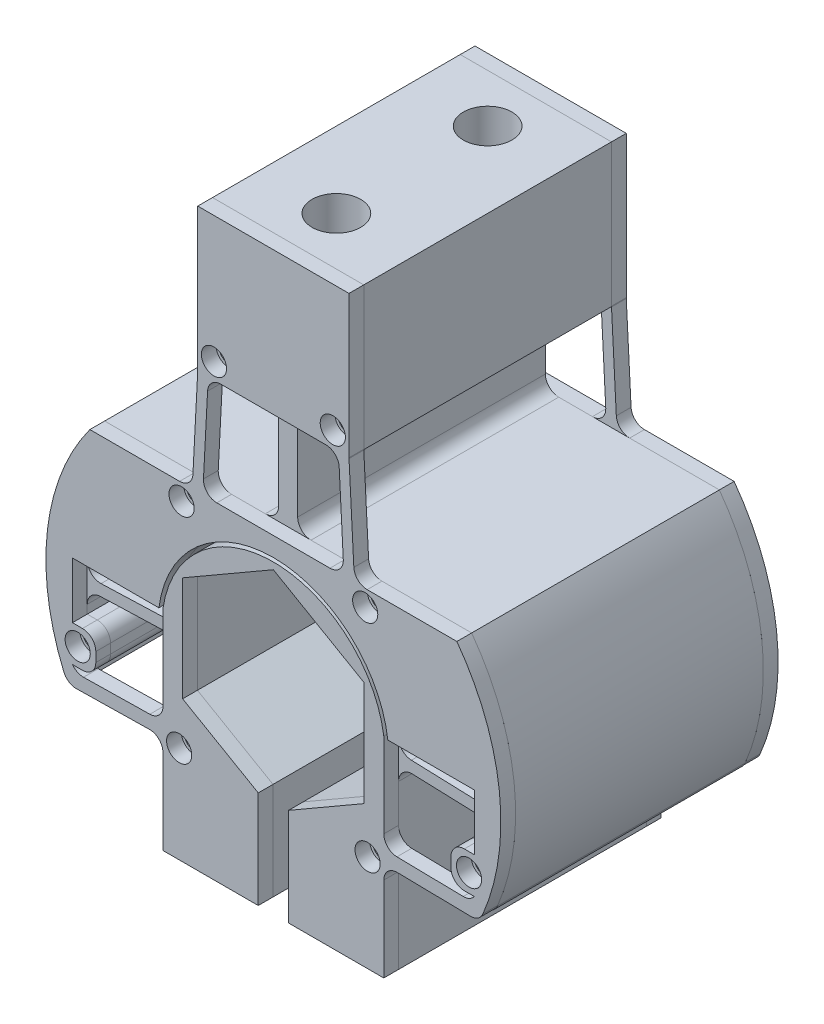
from build123d import *

# Parameters (mm, degrees)
MONKEY_CENTER_W                      = 15.875
MONKEY_CENTER_H                      = 14.97508695
MONKEY_CENTER_W_2                    = 2
MONKEY_CENTER_H_2                    = 11
MONKEY_CENTER_W_3                    = 3.8
MONKEY_CENTER_H_3                    = 3.8
CENTRAL_MONKEY_DEPTH                 = 13
CENTRAL_MONKEY_FILLETS_R             = 1.4
MONKEY_FRONT_W                       = 15.875
MONKEY_FRONT_H                       = 14.97508695
MONKEY_FRONT_W_2                     = 3.8
MONKEY_FRONT_H_2                     = 3.8
FRONT_MONKEY_DEPTH                   = 1.55
FRONT_MONKEY_FILLETS_START           = 13
FRONT_MONKEY_FILLETS_DEPTH           = 1.55
FRONT_MONKEY_FILLETS_2_DEPTH         = 1.55
TAP_DRILL_FOR_3_48_TAP1_AT_2_COUNT   = 2
TAP_DRILL_FOR_3_48_TAP1_AT_2_PITCH   = 14.795945391
TAP_DRILL_FOR_3_48_TAP1_AT_3_COUNT   = 2
TAP_DRILL_FOR_3_48_TAP1_AT_3_PITCH   = 21.43304983
TAP_DRILL_FOR_3_48_TAP1_AT_4_COUNT   = 2
TAP_DRILL_FOR_3_48_TAP1_AT_4_PITCH   = 19.275
TAP_DRILL_FOR_3_48_TAP1_AT_5_COUNT   = 2
TAP_DRILL_FOR_3_48_TAP1_AT_5_PITCH   = 29.842414874
TAP_DRILL_FOR_3_48_TAP1_AT_6_COUNT   = 2
TAP_DRILL_FOR_3_48_TAP1_AT_6_PITCH   = 22.570037672
TAP_DRILL_FOR_3_48_TAP1_AT_7_COUNT   = 2
TAP_DRILL_FOR_3_48_TAP1_AT_7_PITCH   = 21.618193154
TAP_DRILL_FOR_3_48_TAP1_AT_8_COUNT   = 2
TAP_DRILL_FOR_3_48_TAP1_AT_8_PITCH   = 35.483772956
SKETCH33_W                           = 1.3208
SKETCH33_H                           = 29.1
F_3_CLEARANCE_HOLE1_AT_2_COUNT       = 2
F_3_CLEARANCE_HOLE1_AT_2_PITCH       = 12.475
F_3_CLEARANCE_HOLE1_AT_3_COUNT       = 2
F_3_CLEARANCE_HOLE1_AT_3_PITCH       = 14.795945391
F_3_CLEARANCE_HOLE1_AT_4_COUNT       = 2
F_3_CLEARANCE_HOLE1_AT_4_PITCH       = 21.43304983
F_3_CLEARANCE_HOLE1_AT_5_COUNT       = 2
F_3_CLEARANCE_HOLE1_AT_5_PITCH       = 36.028447013
F_3_CLEARANCE_HOLE1_AT_6_COUNT       = 2
F_3_CLEARANCE_HOLE1_AT_6_PITCH       = 37.148402501
F_3_CLEARANCE_HOLE1_AT_7_COUNT       = 2
F_3_CLEARANCE_HOLE1_AT_7_PITCH       = 40.332331117
F_3_CLEARANCE_HOLE1_AT_8_COUNT       = 2
F_3_CLEARANCE_HOLE1_AT_8_PITCH       = 42.549733724
BOLTS_MIRROR_START                   = -16
BOLTS_MIRROR_OUTLINE_R               = 1.3208
BOLTS_MIRROR_DEPTH                   = 4
SKETCH16_W                           = 1.35255
SKETCH16_H                           = 10
TAP_DRILL_FOR_1_4_20_TAP1_AT_2_COUNT = 2
TAP_DRILL_FOR_1_4_20_TAP1_AT_2_PITCH = 15.875


with BuildPart() as part:
    # monkey-center → central-monkey (new, symmetric)
    with BuildSketch(Plane.XY):
        with Locations((0, 32.596196525)):
            Rectangle(MONKEY_CENTER_W, MONKEY_CENTER_H)
        with Locations((0, 19.60865305)):
            Rectangle(MONKEY_CENTER_W_2, MONKEY_CENTER_H_2)
        with BuildLine():
            Line((21.606429043, -10.16), (21.0875, -10.16))
            Line((21.0875, -10.16), (21.0875, 1.524))
            Line((21.0875, 1.524), (12.012364575, 1.524))
            ThreePointArc((12.012364575, 1.524), (0, 12.10865305), (-12.012364575, 1.524))
            Line((-12.012364575, 1.524), (-21.0875, 1.524))
            Line((-21.0875, 1.524), (-21.0875, -10.16))
            Line((-21.0875, -10.16), (-21.606429043, -10.16))
            ThreePointArc((-21.606429043, -10.16), (-23.765328874, 2.296196747), (-19.261601312, 14.10865305))
            Line((-19.261601312, 14.10865305), (19.261601312, 14.10865305))
            ThreePointArc((19.261601312, 14.10865305), (23.765328874, 2.296196747), (21.606429043, -10.16))
        make_face()
        with BuildLine():
            Line((-1.5875, -10.081979076), (-9.525, -5.499261314))
            Line((-9.525, -5.499261314), (-9.525, 5.499261314))
            Line((-9.525, 5.499261314), (0, 10.998522628))
            Line((0, 10.998522628), (9.525, 5.499261314))
            Line((9.525, 5.499261314), (9.525, -5.499261314))
            Line((9.525, -5.499261314), (1.5875, -10.081979076))
            Line((1.5875, -10.081979076), (1.5875, -20.32))
            Line((1.5875, -20.32), (11.5875, -20.32))
            Line((11.5875, -20.32), (11.5875, -1.776731453))
            Line((11.5875, -1.776731453), (11.5875, -0.576))
            Line((11.5875, -0.576), (11.5875, 1.68))
            ThreePointArc((11.5875, 1.68), (0, 11.70865305), (-11.5875, 1.68))
            Line((-11.5875, 1.68), (-11.5875, -0.576))
            Line((-11.5875, -0.576), (-11.5875, -1.776731453))
            Line((-11.5875, -1.776731453), (-11.5875, -20.32))
            Line((-11.5875, -20.32), (-1.5875, -20.32))
            Line((-1.5875, -20.32), (-1.5875, -10.081979076))
        make_face()
        Polygon((-21.0875, -2.108478763), (-11.5875, -1.776731453), (-11.5875, -0.576), (-21.0875, -0.90774731), align=None)
        Polygon((11.5875, -0.576), (11.5875, -1.776731453), (21.0875, -2.108478763), (21.0875, -0.90774731), align=None)
        with Locations((-20.538310453, -6.26)):
            Rectangle(MONKEY_CENTER_W_3, MONKEY_CENTER_H_3)
        with Locations((20.538310453, -6.26)):
            Rectangle(MONKEY_CENTER_W_3, MONKEY_CENTER_H_3)
    extrude(amount=CENTRAL_MONKEY_DEPTH, both=True)

    # central-monkey-fillets
    # the kernel refuses this fillet: 1.4 mm, written as the material it adds along each edge
    with BuildSketch(Plane(origin=(11.5875, -0.576, -13), x_dir=(0.9993908270190959, -0.03489949670249748, 0), z_dir=(0, 0, 1)), Plane(origin=(-21.0875, -2.108478763, -13), x_dir=(0, -1, 0), z_dir=(0, 0, 1))) as central_monkey_fillets_piece_1:
        with BuildLine():
            CenterArc((CENTRAL_MONKEY_FILLETS_R * 0.965688774807, CENTRAL_MONKEY_FILLETS_R), CENTRAL_MONKEY_FILLETS_R, 182, 88)
            Line((-CENTRAL_MONKEY_FILLETS_R * 0.033702052212, CENTRAL_MONKEY_FILLETS_R * 0.965100503298), (0, 0))
            Line((0, 0), (CENTRAL_MONKEY_FILLETS_R * 0.965688774807, 0))
        make_face()
    extrude(amount=26)
    with BuildSketch(Plane(origin=(21.0875, -0.90774731, -13), x_dir=(0, 1, 0), z_dir=(0, 0, 1)), Plane(origin=(-21.0875, -0.90774731, 13), x_dir=(0, 1, 0), z_dir=(0, 0, -1)), Plane(origin=(-11.5875, -1.776731453, -13), x_dir=(-0.9993908270190958, -0.03489949670249787, 0), z_dir=(0, 0, 1))) as central_monkey_fillets_piece_2:
        with BuildLine():
            CenterArc((CENTRAL_MONKEY_FILLETS_R * 1.03553031379, CENTRAL_MONKEY_FILLETS_R), CENTRAL_MONKEY_FILLETS_R, 178, 92)
            Line((CENTRAL_MONKEY_FILLETS_R * 0.0361394867715, CENTRAL_MONKEY_FILLETS_R * 1.0348994967), (0, 0))
            Line((0, 0), (CENTRAL_MONKEY_FILLETS_R * 1.03553031379, 0))
        make_face()
    extrude(amount=26)
    with BuildSketch(Plane(origin=(-11.5875, -0.576, 13), x_dir=(0, 1, 0), z_dir=(0, 0, -1)), Plane(origin=(21.0875, -2.108478763, 13), x_dir=(-0.9993908270190959, 0.03489949670249678, 0), z_dir=(0, 0, -1))) as central_monkey_fillets_piece_3:
        with BuildLine():
            CenterArc((CENTRAL_MONKEY_FILLETS_R * 0.965688774807, -CENTRAL_MONKEY_FILLETS_R), CENTRAL_MONKEY_FILLETS_R, 90, 88)
            Line((-CENTRAL_MONKEY_FILLETS_R * 0.033702052212, -CENTRAL_MONKEY_FILLETS_R * 0.965100503298), (0, 0))
            Line((0, 0), (CENTRAL_MONKEY_FILLETS_R * 0.965688774807, 0))
        make_face()
    extrude(amount=26)
    with BuildSketch(Plane(origin=(-1, 14.10865305, -13), x_dir=(0, 1, 0), z_dir=(0, 0, 1)), Plane(origin=(-1, 25.10865305, -13), x_dir=(-1, 0, 0), z_dir=(0, 0, 1))) as central_monkey_fillets_piece_4:
        with BuildLine():
            CenterArc((CENTRAL_MONKEY_FILLETS_R, CENTRAL_MONKEY_FILLETS_R), CENTRAL_MONKEY_FILLETS_R, 180, 90)
            Line((0, CENTRAL_MONKEY_FILLETS_R), (0, 0))
            Line((0, 0), (CENTRAL_MONKEY_FILLETS_R, 0))
        make_face()
    extrude(amount=26)
    with BuildSketch(Plane(origin=(1, 25.10865305, 13), x_dir=(0, -1, 0), z_dir=(0, 0, -1)), Plane(origin=(1, 14.10865305, 13), x_dir=(1, 0, 0), z_dir=(0, 0, -1))) as central_monkey_fillets_piece_5:
        with BuildLine():
            CenterArc((CENTRAL_MONKEY_FILLETS_R, -CENTRAL_MONKEY_FILLETS_R), CENTRAL_MONKEY_FILLETS_R, 90, 90)
            Line((0, -CENTRAL_MONKEY_FILLETS_R), (0, 0))
            Line((0, 0), (CENTRAL_MONKEY_FILLETS_R, 0))
        make_face()
    extrude(amount=26)
    with BuildSketch(Plane(origin=(11.5875, -1.776731453, 13), x_dir=(0, -1, 0), z_dir=(0, 0, -1))) as central_monkey_fillets_piece_6:
        with BuildLine():
            CenterArc((CENTRAL_MONKEY_FILLETS_R * 1.03553031379, -CENTRAL_MONKEY_FILLETS_R), CENTRAL_MONKEY_FILLETS_R, 90, 92)
            Line((CENTRAL_MONKEY_FILLETS_R * 0.0361394867715, -CENTRAL_MONKEY_FILLETS_R * 1.0348994967), (0, 0))
            Line((0, 0), (CENTRAL_MONKEY_FILLETS_R * 1.03553031379, 0))
        make_face()
    extrude(amount=26)
    # the kernel refuses this fillet: 1.4 mm, written as the material it takes off along each edge
    with BuildSketch(Plane(origin=(-18.638310453, -8.16, 16.5), x_dir=(0, 1, 0), z_dir=(0, 0, -1)), Plane(origin=(18.638310453, -4.36, 16.5), x_dir=(0, -1, 0), z_dir=(0, 0, -1))) as central_monkey_fillets_2_piece_1:
        with BuildLine():
            CenterArc((CENTRAL_MONKEY_FILLETS_R, -CENTRAL_MONKEY_FILLETS_R), CENTRAL_MONKEY_FILLETS_R, 90, 90)
            Line((0, -CENTRAL_MONKEY_FILLETS_R), (0, 0))
            Line((0, 0), (CENTRAL_MONKEY_FILLETS_R, 0))
        make_face()
    extrude(amount=33, mode=Mode.SUBTRACT)
    with BuildSketch(Plane(origin=(-18.638310453, -4.36, -16.5), x_dir=(-1, 0, 0), z_dir=(0, 0, 1)), Plane(origin=(18.638310453, -8.16, -16.5), x_dir=(1, 0, 0), z_dir=(0, 0, 1))) as central_monkey_fillets_2_piece_2:
        with BuildLine():
            CenterArc((CENTRAL_MONKEY_FILLETS_R, CENTRAL_MONKEY_FILLETS_R), CENTRAL_MONKEY_FILLETS_R, 180, 90)
            Line((0, CENTRAL_MONKEY_FILLETS_R), (0, 0))
            Line((0, 0), (CENTRAL_MONKEY_FILLETS_R, 0))
        make_face()
    extrude(amount=33, mode=Mode.SUBTRACT)
    with BuildSketch(Plane(origin=(-21.606429043, -10.16, -15.15694949), x_dir=(-0.40911199737648846, 0.9124841771793197, 0), z_dir=(0, 0, 1)), Plane(origin=(21.606429043, -10.16, 15.15694949), x_dir=(0.40911199737648424, 0.9124841771793215, 0), z_dir=(0, 0, -1))) as central_monkey_fillets_2_piece_3:
        with BuildLine():
            CenterArc((0.837484694, -1.399771466), CENTRAL_MONKEY_FILLETS_R, 88.96472753, 49.612336383)
            Line((-0.212300097, -0.473514541), (0, 0))
            ThreePointArc((0, 0), (0.431389898, 0.003897479), (0.862779796, 0))
        make_face()
    extrude(amount=30.313898981, mode=Mode.SUBTRACT)


with BuildPart() as body_2:
    # monkey-front → front-monkey (new body)
    with BuildSketch(Plane.XY.offset(13)):
        with Locations((0, 32.596196525)):
            Rectangle(MONKEY_FRONT_W, MONKEY_FRONT_H)
        Polygon((-7.9375, 25.10865305), (-8.513985572, 14.10865305), (-7.413985572, 14.10865305), (-6.8375, 25.10865305), align=None)
        Polygon((7.413985572, 14.10865305), (8.513985572, 14.10865305), (7.9375, 25.10865305), (6.8375, 25.10865305), align=None)
        with BuildLine():
            Line((21.606429043, -10.16), (21.0875, -10.16))
            Line((21.0875, -10.16), (21.0875, 1.524))
            Line((21.0875, 1.524), (12.012364575, 1.524))
            ThreePointArc((12.012364575, 1.524), (0, 12.10865305), (-12.012364575, 1.524))
            Line((-12.012364575, 1.524), (-21.0875, 1.524))
            Line((-21.0875, 1.524), (-21.0875, -10.16))
            Line((-21.0875, -10.16), (-21.606429043, -10.16))
            ThreePointArc((-21.606429043, -10.16), (-23.765328874, 2.296196747), (-19.261601312, 14.10865305))
            Line((-19.261601312, 14.10865305), (19.261601312, 14.10865305))
            ThreePointArc((19.261601312, 14.10865305), (23.765328874, 2.296196747), (21.606429043, -10.16))
        make_face()
        with BuildLine():
            Line((-1.5875, -10.081979076), (-9.525, -5.499261314))
            Line((-9.525, -5.499261314), (-9.525, 5.499261314))
            Line((-9.525, 5.499261314), (0, 10.998522628))
            Line((0, 10.998522628), (9.525, 5.499261314))
            Line((9.525, 5.499261314), (9.525, -5.499261314))
            Line((9.525, -5.499261314), (1.5875, -10.081979076))
            Line((1.5875, -10.081979076), (1.5875, -20.32))
            Line((1.5875, -20.32), (11.5875, -20.32))
            Line((11.5875, -20.32), (11.5875, -9.994176883))
            Line((11.5875, -9.994176883), (11.5875, -8.594176883))
            Line((11.5875, -8.594176883), (11.5875, 1.68))
            ThreePointArc((11.5875, 1.68), (0, 11.70865305), (-11.5875, 1.68))
            Line((-11.5875, 1.68), (-11.5875, -8.594176883))
            Line((-11.5875, -8.594176883), (-11.5875, -9.994176883))
            Line((-11.5875, -9.994176883), (-11.5875, -20.32))
            Line((-11.5875, -20.32), (-1.5875, -20.32))
            Line((-1.5875, -20.32), (-1.5875, -10.081979076))
        make_face()
        Polygon((-21.0875, -10.16), (-11.5875, -9.994176883), (-11.5875, -8.594176883), (-21.0875, -8.76), align=None)
        Polygon((11.5875, -8.594176883), (11.5875, -9.994176883), (21.0875, -10.16), (21.0875, -8.76), align=None)
        with Locations((-20.538310453, -6.26)):
            Rectangle(MONKEY_FRONT_W_2, MONKEY_FRONT_H_2)
        with Locations((20.538310453, -6.26)):
            Rectangle(MONKEY_FRONT_W_2, MONKEY_FRONT_H_2)
    extrude(amount=FRONT_MONKEY_DEPTH)

    # front-monkey-fillets: read off the stored shape, not the designer's step
    # front-monkey-fillets outline → front-monkey-fillets (cut)
    with BuildSketch(Plane.XY.offset(FRONT_MONKEY_FILLETS_START)):
        with BuildLine():
            Line((18.638310453, -4.36), (18.638310453, -5.76))
            ThreePointArc((18.638310453, -5.76), (19.04836096, -4.770050506), (20.038310453, -4.36))
            Line((20.038310453, -4.36), (18.638310453, -4.36))
        make_face()
        with BuildLine():
            ThreePointArc((20.038310453, -8.16), (19.04836096, -7.749949494), (18.638310453, -6.76))
            Line((18.638310453, -6.76), (18.638310453, -8.16))
            Line((18.638310453, -8.16), (20.038310453, -8.16))
        make_face()
        with BuildLine():
            Line((-18.638310453, -4.36), (-20.038310453, -4.36))
            ThreePointArc((-20.038310453, -4.36), (-19.04836096, -4.770050506), (-18.638310453, -5.76))
            Line((-18.638310453, -5.76), (-18.638310453, -4.36))
        make_face()
        with BuildLine():
            Line((-18.638310453, -8.16), (-18.638310453, -6.76))
            ThreePointArc((-18.638310453, -6.76), (-19.04836096, -7.749949493), (-20.038310453, -8.16))
            Line((-20.038310453, -8.16), (-18.638310453, -8.16))
        make_face()
        with BuildLine():
            ThreePointArc((21.606429043, -10.16), (21.802989861, -9.731033302), (21.991035125, -9.298265973))
            ThreePointArc((21.991035125, -9.298265973), (21.464880219, -9.926654032), (20.677129099, -10.152836949))
            Line((20.677129099, -10.152836949), (21.0875, -10.16))
            Line((21.0875, -10.16), (21.606429043, -10.16))
        make_face()
        with BuildLine():
            ThreePointArc((-20.677129099, -10.152836949), (-21.464880219, -9.926654032), (-21.991035126, -9.298265973))
            ThreePointArc((-21.991035126, -9.298265973), (-21.802989861, -9.731033302), (-21.606429043, -10.16))
            Line((-21.606429043, -10.16), (-21.0875, -10.16))
            Line((-21.0875, -10.16), (-20.677129099, -10.152836949))
        make_face()
    extrude(amount=FRONT_MONKEY_FILLETS_DEPTH, mode=Mode.SUBTRACT)

    # front-monkey-fillets 2 outline → front-monkey-fillets 2 (add)
    with BuildSketch(Plane.XY.offset(FRONT_MONKEY_FILLETS_START)):
        with BuildLine():
            Line((11.5875, -8.594176883), (12.963066631, -8.618187488))
            ThreePointArc((12.963066631, -8.618187488), (11.988949371, -8.199673685), (11.5875, -7.218400715))
            Line((11.5875, -7.218400715), (11.5875, -8.594176883))
        make_face()
        with BuildLine():
            Line((21.0875, -8.76), (21.0875, -8.16))
            ThreePointArc((21.0875, -8.16), (20.579057304, -8.592094016), (19.928356233, -8.73976707))
            Line((19.928356233, -8.73976707), (21.0875, -8.76))
        make_face()
        with BuildLine():
            ThreePointArc((-11.5875, -7.218400715), (-11.988949371, -8.199673685), (-12.963066631, -8.618187488))
            Line((-12.963066631, -8.618187488), (-11.5875, -8.594176883))
            Line((-11.5875, -8.594176883), (-11.5875, -7.218400715))
        make_face()
        with BuildLine():
            ThreePointArc((-19.928356233, -8.73976707), (-20.579057304, -8.592094016), (-21.0875, -8.16))
            Line((-21.0875, -8.16), (-21.0875, -8.76))
            Line((-21.0875, -8.76), (-19.928356233, -8.73976707))
        make_face()
        with BuildLine():
            ThreePointArc((11.5875, -11.418827233), (12.00622703, -10.420276605), (13.011933369, -10.01904046))
            Line((13.011933369, -10.01904046), (11.5875, -9.994176883))
            Line((11.5875, -9.994176883), (11.5875, -11.418827233))
        make_face()
        with BuildLine():
            ThreePointArc((9.842535966, 14.10865305), (8.87883956, 14.493128931), (8.444454617, 15.435382711))
            Line((8.444454617, 15.435382711), (8.513985572, 14.10865305))
            Line((8.513985572, 14.10865305), (9.842535966, 14.10865305))
        make_face()
        with BuildLine():
            ThreePointArc((7.939418651, 25.072043002), (7.937979745, 25.108665613), (7.9375, 25.14531334))
            Line((7.9375, 25.14531334), (7.9375, 25.10865305))
            Line((7.9375, 25.10865305), (7.939418651, 25.072043002))
        make_face()
        with BuildLine():
            Line((-11.5875, -9.994176883), (-13.011933369, -10.01904046))
            ThreePointArc((-13.011933369, -10.01904046), (-12.00622703, -10.420276605), (-11.5875, -11.418827233))
            Line((-11.5875, -11.418827233), (-11.5875, -9.994176883))
        make_face()
        with BuildLine():
            Line((-8.513985572, 14.10865305), (-8.444454617, 15.435382711))
            ThreePointArc((-8.444454617, 15.435382711), (-8.87883956, 14.493128931), (-9.842535966, 14.10865305))
            Line((-9.842535966, 14.10865305), (-8.513985572, 14.10865305))
        make_face()
        with BuildLine():
            ThreePointArc((-7.9375, 25.14531334), (-7.937979745, 25.108665613), (-7.939418651, 25.072043002))
            Line((-7.939418651, 25.072043002), (-7.9375, 25.10865305))
            Line((-7.9375, 25.10865305), (-7.9375, 25.14531334))
        make_face()
        with BuildLine():
            ThreePointArc((-6.907030955, 23.781923389), (-6.472646013, 24.72417717), (-5.508949607, 25.10865305))
            Line((-5.508949607, 25.10865305), (-6.8375, 25.10865305))
            Line((-6.8375, 25.10865305), (-6.907030955, 23.781923389))
        make_face()
        with BuildLine():
            Line((6.8375, 25.10865305), (5.508949607, 25.10865305))
            ThreePointArc((5.508949607, 25.10865305), (6.472646013, 24.72417717), (6.907030955, 23.781923389))
            Line((6.907030955, 23.781923389), (6.8375, 25.10865305))
        make_face()
        with BuildLine():
            ThreePointArc((-5.938693397, 14.10865305), (-6.954217516, 14.544956644), (-7.336774745, 15.581923389))
            Line((-7.336774745, 15.581923389), (-7.413985572, 14.10865305))
            Line((-7.413985572, 14.10865305), (-5.938693397, 14.10865305))
        make_face()
        with BuildLine():
            Line((7.413985572, 14.10865305), (7.336774745, 15.581923389))
            ThreePointArc((7.336774745, 15.581923389), (6.954217516, 14.544956644), (5.938693397, 14.10865305))
            Line((5.938693397, 14.10865305), (7.413985572, 14.10865305))
        make_face()
    extrude(amount=FRONT_MONKEY_FILLETS_2_DEPTH)


with BuildPart() as body_3:
    # back-monkey: mirrored copy
    add(body_2.part.mirror(Plane.XY))

    # bolts-mirror: read off the stored shape, not the designer's step
    # bolts-mirror outline → bolts-mirror (cut)
    with BuildSketch(Plane.XY.offset(BOLTS_MIRROR_START)):
        with Locations((-6.2375, 26.80865305)):
            Circle(BOLTS_MIRROR_OUTLINE_R)
        with Locations((20.538310453, -6.26)):
            Circle(BOLTS_MIRROR_OUTLINE_R)
        with Locations((9.8875, -10.16)):
            Circle(BOLTS_MIRROR_OUTLINE_R)
        with Locations((-9.8875, -10.16)):
            Circle(BOLTS_MIRROR_OUTLINE_R)
        with Locations((-20.538310453, -6.26)):
            Circle(BOLTS_MIRROR_OUTLINE_R)
        with Locations((9.6375, 12.40865305)):
            Circle(BOLTS_MIRROR_OUTLINE_R)
        with Locations((-9.6375, 12.40865305)):
            Circle(BOLTS_MIRROR_OUTLINE_R)
        with Locations((6.2375, 26.80865305)):
            Circle(BOLTS_MIRROR_OUTLINE_R)
    extrude(amount=BOLTS_MIRROR_DEPTH, mode=Mode.SUBTRACT)


with BuildPart() as tap_drill_for_3_48_tap1_tool:
    # Sketch26 → Tap Drill for #3-48 Tap1 (revolve)
    with BuildSketch(Plane(origin=(-9.6375, 12.40865305, 14.55), x_dir=(0, -1, 0), z_dir=(1, 0, 0))):
        Polygon((0, 0), (0, 6.999027994), (0.99695, 6.4), (0.99695, 0), align=None)
    tap_drill_for_3_48_tap1 = revolve(axis=Axis((-9.6375, 12.40865305, 20.9), (0, 0, -1)))


with BuildPart() as part_1:
    add(part.part)

    # Tap Drill for #3-48 Tap1: cut by tap_drill_for_3_48_tap1_tool
    add(tap_drill_for_3_48_tap1_tool.part, mode=Mode.SUBTRACT)


with BuildPart() as body_2_1:
    add(body_2.part)

    # Tap Drill for #3-48 Tap1: cut by tap_drill_for_3_48_tap1_tool
    add(tap_drill_for_3_48_tap1_tool.part, mode=Mode.SUBTRACT)


with BuildPart() as tap_drill_for_3_48_tap1_at_2_tool:
    # Tap Drill for #3-48 Tap1 at 2: Tap Drill for #3-48 Tap1 ×2
    with Locations(*[Vector(0.22979268375595713, 0.9732396017899368, 0) * (i * TAP_DRILL_FOR_3_48_TAP1_AT_2_PITCH) for i in range(1, TAP_DRILL_FOR_3_48_TAP1_AT_2_COUNT)]):
        add(tap_drill_for_3_48_tap1)


with BuildPart() as part_2:
    add(part_1.part)

    # Tap Drill for #3-48 Tap1 at 2: cut by tap_drill_for_3_48_tap1_at_2_tool
    add(tap_drill_for_3_48_tap1_at_2_tool.part, mode=Mode.SUBTRACT)


with BuildPart() as body_2_2:
    add(body_2_1.part)

    # Tap Drill for #3-48 Tap1 at 2: cut by tap_drill_for_3_48_tap1_at_2_tool
    add(tap_drill_for_3_48_tap1_at_2_tool.part, mode=Mode.SUBTRACT)


with BuildPart() as tap_drill_for_3_48_tap1_at_3_tool:
    # Tap Drill for #3-48 Tap1 at 3: Tap Drill for #3-48 Tap1 ×2
    with Locations(*[Vector(0.7406785374073726, 0.6718595866876319, 0) * (i * TAP_DRILL_FOR_3_48_TAP1_AT_3_PITCH) for i in range(1, TAP_DRILL_FOR_3_48_TAP1_AT_3_COUNT)]):
        add(tap_drill_for_3_48_tap1)


with BuildPart() as part_3:
    add(part_2.part)

    # Tap Drill for #3-48 Tap1 at 3: cut by tap_drill_for_3_48_tap1_at_3_tool
    add(tap_drill_for_3_48_tap1_at_3_tool.part, mode=Mode.SUBTRACT)


with BuildPart() as body_2_3:
    add(body_2_2.part)

    # Tap Drill for #3-48 Tap1 at 3: cut by tap_drill_for_3_48_tap1_at_3_tool
    add(tap_drill_for_3_48_tap1_at_3_tool.part, mode=Mode.SUBTRACT)


with BuildPart() as tap_drill_for_3_48_tap1_at_4_tool:
    # Tap Drill for #3-48 Tap1 at 4: Tap Drill for #3-48 Tap1 ×2
    with Locations(*[(i * TAP_DRILL_FOR_3_48_TAP1_AT_4_PITCH, 0, 0) for i in range(1, TAP_DRILL_FOR_3_48_TAP1_AT_4_COUNT)]):
        add(tap_drill_for_3_48_tap1)


with BuildPart() as part_4:
    add(part_3.part)

    # Tap Drill for #3-48 Tap1 at 4: cut by tap_drill_for_3_48_tap1_at_4_tool
    add(tap_drill_for_3_48_tap1_at_4_tool.part, mode=Mode.SUBTRACT)


with BuildPart() as body_2_4:
    add(body_2_3.part)

    # Tap Drill for #3-48 Tap1 at 4: cut by tap_drill_for_3_48_tap1_at_4_tool
    add(tap_drill_for_3_48_tap1_at_4_tool.part, mode=Mode.SUBTRACT)


with BuildPart() as tap_drill_for_3_48_tap1_at_5_tool:
    # Tap Drill for #3-48 Tap1 at 5: Tap Drill for #3-48 Tap1 ×2
    with Locations(*[Vector(0.6542701079173613, -0.7562609509195913, 0) * (i * TAP_DRILL_FOR_3_48_TAP1_AT_5_PITCH) for i in range(1, TAP_DRILL_FOR_3_48_TAP1_AT_5_COUNT)]):
        add(tap_drill_for_3_48_tap1)


with BuildPart() as part_5:
    add(part_4.part)

    # Tap Drill for #3-48 Tap1 at 5: cut by tap_drill_for_3_48_tap1_at_5_tool
    add(tap_drill_for_3_48_tap1_at_5_tool.part, mode=Mode.SUBTRACT)


with BuildPart() as body_2_5:
    add(body_2_4.part)

    # Tap Drill for #3-48 Tap1 at 5: cut by tap_drill_for_3_48_tap1_at_5_tool
    add(tap_drill_for_3_48_tap1_at_5_tool.part, mode=Mode.SUBTRACT)


with BuildPart() as tap_drill_for_3_48_tap1_at_6_tool:
    # Tap Drill for #3-48 Tap1 at 6: Tap Drill for #3-48 Tap1 ×2
    with Locations(*[Vector(-0.011076631932867537, -0.9999386522307375, 0) * (i * TAP_DRILL_FOR_3_48_TAP1_AT_6_PITCH) for i in range(1, TAP_DRILL_FOR_3_48_TAP1_AT_6_COUNT)]):
        add(tap_drill_for_3_48_tap1)


with BuildPart() as part_6:
    add(part_5.part)

    # Tap Drill for #3-48 Tap1 at 6: cut by tap_drill_for_3_48_tap1_at_6_tool
    add(tap_drill_for_3_48_tap1_at_6_tool.part, mode=Mode.SUBTRACT)


with BuildPart() as body_2_6:
    add(body_2_5.part)

    # Tap Drill for #3-48 Tap1 at 6: cut by tap_drill_for_3_48_tap1_at_6_tool
    add(tap_drill_for_3_48_tap1_at_6_tool.part, mode=Mode.SUBTRACT)


with BuildPart() as tap_drill_for_3_48_tap1_at_7_tool:
    # Tap Drill for #3-48 Tap1 at 7: Tap Drill for #3-48 Tap1 ×2
    with Locations(*[Vector(-0.5042424394870968, -0.8635621357031014, 0) * (i * TAP_DRILL_FOR_3_48_TAP1_AT_7_PITCH) for i in range(1, TAP_DRILL_FOR_3_48_TAP1_AT_7_COUNT)]):
        add(tap_drill_for_3_48_tap1)


with BuildPart() as part_7:
    add(part_6.part)

    # Tap Drill for #3-48 Tap1 at 7: cut by tap_drill_for_3_48_tap1_at_7_tool
    add(tap_drill_for_3_48_tap1_at_7_tool.part, mode=Mode.SUBTRACT)


with BuildPart() as body_2_7:
    add(body_2_6.part)

    # Tap Drill for #3-48 Tap1 at 7: cut by tap_drill_for_3_48_tap1_at_7_tool
    add(tap_drill_for_3_48_tap1_at_7_tool.part, mode=Mode.SUBTRACT)


with BuildPart() as tap_drill_for_3_48_tap1_at_8_tool:
    # Tap Drill for #3-48 Tap1 at 8: Tap Drill for #3-48 Tap1 ×2
    with Locations(*[Vector(0.8504115526377282, -0.5261180391701927, 0) * (i * TAP_DRILL_FOR_3_48_TAP1_AT_8_PITCH) for i in range(1, TAP_DRILL_FOR_3_48_TAP1_AT_8_COUNT)]):
        add(tap_drill_for_3_48_tap1)


with BuildPart() as part_8:
    add(part_7.part)

    # Tap Drill for #3-48 Tap1 at 8: cut by tap_drill_for_3_48_tap1_at_8_tool
    add(tap_drill_for_3_48_tap1_at_8_tool.part, mode=Mode.SUBTRACT)

    # bolts-mirror 2 outline → bolts-mirror 2 (revolve, cut)
    with BuildSketch(Plane(origin=(20.538310453, -6.26, 0), x_dir=(1, 0, 0), z_dir=(0, -1, 0))):
        Polygon((0.99695, -13), (0.99695, -8.15), (0, -7.550972006), (0, -13), align=None)
    revolve(axis=Axis((20.538310453, -6.26, 0), (0, 0, 1)), mode=Mode.SUBTRACT)

    # bolts-mirror 3 outline → bolts-mirror 3 (revolve, cut)
    with BuildSketch(Plane(origin=(-20.538310453, -6.26, 0), x_dir=(1, 0, 0), z_dir=(0, -1, 0))):
        Polygon((0.99695, -13), (0.99695, -8.15), (0, -7.550972006), (0, -13), align=None)
    revolve(axis=Axis((-20.538310453, -6.26, 0), (0, 0, 1)), mode=Mode.SUBTRACT)

    # bolts-mirror 4 outline → bolts-mirror 4 (revolve, cut)
    with BuildSketch(Plane(origin=(-9.8875, -10.16, 0), x_dir=(1, 0, 0), z_dir=(0, -1, 0))):
        Polygon((0.99695, -13), (0.99695, -8.15), (0, -7.550972006), (0, -13), align=None)
    revolve(axis=Axis((-9.8875, -10.16, 0), (0, 0, 1)), mode=Mode.SUBTRACT)

    # bolts-mirror 5 outline → bolts-mirror 5 (revolve, cut)
    with BuildSketch(Plane(origin=(9.8875, -10.16, 0), x_dir=(1, 0, 0), z_dir=(0, -1, 0))):
        Polygon((0.99695, -13), (0.99695, -8.15), (0, -7.550972006), (0, -13), align=None)
    revolve(axis=Axis((9.8875, -10.16, 0), (0, 0, 1)), mode=Mode.SUBTRACT)

    # bolts-mirror 6 outline → bolts-mirror 6 (revolve, cut)
    with BuildSketch(Plane(origin=(9.6375, 12.40865305, 0), x_dir=(1, 0, 0), z_dir=(0, -1, 0))):
        Polygon((0.99695, -13), (0.99695, -8.15), (0, -7.550972006), (0, -13), align=None)
    revolve(axis=Axis((9.6375, 12.40865305, 0), (0, 0, 1)), mode=Mode.SUBTRACT)

    # bolts-mirror 7 outline → bolts-mirror 7 (revolve, cut)
    with BuildSketch(Plane(origin=(6.2375, 26.80865305, 0), x_dir=(1, 0, 0), z_dir=(0, -1, 0))):
        Polygon((0.99695, -13), (0.99695, -8.15), (0, -7.550972006), (0, -13), align=None)
    revolve(axis=Axis((6.2375, 26.80865305, 0), (0, 0, 1)), mode=Mode.SUBTRACT)

    # bolts-mirror 8 outline → bolts-mirror 8 (revolve, cut)
    with BuildSketch(Plane(origin=(-6.2375, 26.80865305, 0), x_dir=(1, 0, 0), z_dir=(0, -1, 0))):
        Polygon((0.99695, -13), (0.99695, -8.15), (0, -7.550972006), (0, -13), align=None)
    revolve(axis=Axis((-6.2375, 26.80865305, 0), (0, 0, 1)), mode=Mode.SUBTRACT)

    # bolts-mirror 9 outline → bolts-mirror 9 (revolve, cut)
    with BuildSketch(Plane(origin=(-9.6375, 12.40865305, 0), x_dir=(1, 0, 0), z_dir=(0, -1, 0))):
        Polygon((0.99695, -13), (0.99695, -8.15), (0, -7.550972006), (0, -13), align=None)
    revolve(axis=Axis((-9.6375, 12.40865305, 0), (0, 0, 1)), mode=Mode.SUBTRACT)

    # Sketch13 → CBORE for #6 Socket Head Cap Screw1 (revolve, cut)
    with BuildSketch(Plane(origin=(11.5875, -15.24, 0), x_dir=(0, 0, -1), z_dir=(0, 1, 0))):
        Polygon((0, 0), (0, 10), (1.89865, 10), (1.89865, 3.5052), (3.57251, 3.5052), (3.57251, 0), align=None)
    revolve(axis=Axis((17.9375, -15.24, 0), (-1, 0, 0)), mode=Mode.SUBTRACT)

    # Sketch16 → Tap Drill for #6-32 Tap1 (revolve, cut)
    with BuildSketch(Plane(origin=(-11.5875, -15.24, 0), x_dir=(0, 0, 1), z_dir=(0, 1, 0))):
        with Locations((0.676275, 5)):
            Rectangle(SKETCH16_W, SKETCH16_H)
    revolve(axis=Axis((-17.9375, -15.24, 0), (1, 0, 0)), mode=Mode.SUBTRACT)

    # Sketch19 → Tap Drill for 1/4-20 Tap1 (revolve, cut)
    with BuildSketch(Plane(origin=(0, 40.08374, 7.9375), x_dir=(0, 0, 1), z_dir=(1, 0, 0))):
        Polygon((0, 0), (0, 11.693816902), (2.5527, 10.16), (2.5527, 0), align=None)
    tap_drill_for_1_4_20_tap1 = revolve(axis=Axis((0, 46.43374, 7.9375), (0, -1, 0)), mode=Mode.SUBTRACT)

    # Tap Drill for 1/4-20 Tap1 at 2: Tap Drill for 1/4-20 Tap1 ×2
    with Locations(*[(0, 0, -i * TAP_DRILL_FOR_1_4_20_TAP1_AT_2_PITCH) for i in range(1, TAP_DRILL_FOR_1_4_20_TAP1_AT_2_COUNT)]):
        add(tap_drill_for_1_4_20_tap1, mode=Mode.SUBTRACT)


with BuildPart() as body_2_8:
    add(body_2_7.part)

    # Tap Drill for #3-48 Tap1 at 8: cut by tap_drill_for_3_48_tap1_at_8_tool
    add(tap_drill_for_3_48_tap1_at_8_tool.part, mode=Mode.SUBTRACT)

    # Sketch33 → #3 Clearance Hole1 (revolve, cut)
    with BuildSketch(Plane(origin=(-6.2375, 26.80865305, 14.55), x_dir=(0, -1, 0), z_dir=(1, 0, 0))):
        with Locations((0.6604, 14.55)):
            Rectangle(SKETCH33_W, SKETCH33_H)
    f_3_clearance_hole1 = revolve(axis=Axis((-6.2375, 26.80865305, 20.9), (0, 0, -1)), mode=Mode.SUBTRACT)

    # #3 Clearance Hole1 at 2: #3 Clearance Hole1 ×2
    with Locations(*[(i * F_3_CLEARANCE_HOLE1_AT_2_PITCH, 0, 0) for i in range(1, F_3_CLEARANCE_HOLE1_AT_2_COUNT)]):
        add(f_3_clearance_hole1, mode=Mode.SUBTRACT)

    # #3 Clearance Hole1 at 3: #3 Clearance Hole1 ×2
    with Locations(*[Vector(-0.22979268375595713, -0.9732396017899368, 0) * (i * F_3_CLEARANCE_HOLE1_AT_3_PITCH) for i in range(1, F_3_CLEARANCE_HOLE1_AT_3_COUNT)]):
        add(f_3_clearance_hole1, mode=Mode.SUBTRACT)

    # #3 Clearance Hole1 at 4: #3 Clearance Hole1 ×2
    with Locations(*[Vector(0.7406785374073726, -0.6718595866876319, 0) * (i * F_3_CLEARANCE_HOLE1_AT_4_PITCH) for i in range(1, F_3_CLEARANCE_HOLE1_AT_4_COUNT)]):
        add(f_3_clearance_hole1, mode=Mode.SUBTRACT)

    # #3 Clearance Hole1 at 5: #3 Clearance Hole1 ×2
    with Locations(*[Vector(-0.39693108193435794, -0.9178484167848306, 0) * (i * F_3_CLEARANCE_HOLE1_AT_5_PITCH) for i in range(1, F_3_CLEARANCE_HOLE1_AT_5_COUNT)]):
        add(f_3_clearance_hole1, mode=Mode.SUBTRACT)

    # #3 Clearance Hole1 at 6: #3 Clearance Hole1 ×2
    with Locations(*[Vector(-0.09825456155056866, -0.9951613141267629, 0) * (i * F_3_CLEARANCE_HOLE1_AT_6_PITCH) for i in range(1, F_3_CLEARANCE_HOLE1_AT_6_COUNT)]):
        add(f_3_clearance_hole1, mode=Mode.SUBTRACT)

    # #3 Clearance Hole1 at 7: #3 Clearance Hole1 ×2
    with Locations(*[Vector(0.39980332287636233, -0.9166009508052123, 0) * (i * F_3_CLEARANCE_HOLE1_AT_7_PITCH) for i in range(1, F_3_CLEARANCE_HOLE1_AT_7_COUNT)]):
        add(f_3_clearance_hole1, mode=Mode.SUBTRACT)

    # #3 Clearance Hole1 at 8: #3 Clearance Hole1 ×2
    with Locations(*[Vector(0.6292826795810847, -0.7771764980873069, 0) * (i * F_3_CLEARANCE_HOLE1_AT_8_PITCH) for i in range(1, F_3_CLEARANCE_HOLE1_AT_8_COUNT)]):
        add(f_3_clearance_hole1, mode=Mode.SUBTRACT)


solid = Compound([body_3.part, part_8.part, body_2_8.part])
